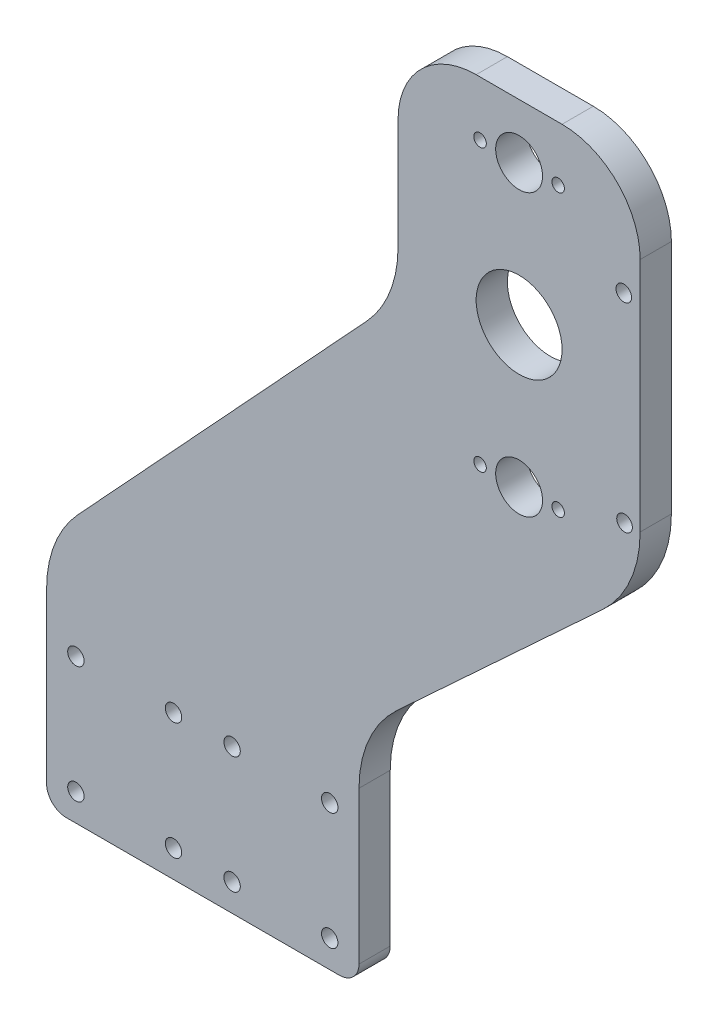
from build123d import *

# Parameters (mm, degrees)
SKETCH1_R           = 2.1
SKETCH1_R_2         = 6
SKETCH1_R_3         = 11
SKETCH1_R_4         = 2
SKETCH1_R_5         = 1.6
BOSS_EXTRUDE1_DEPTH = 8


with BuildPart() as part:
    # Sketch1 → Boss-Extrude1 (new body)
    with BuildSketch(Plane.XY):
        with BuildLine():
            Line((-58.426247288, -99.197523475), (11.573752712, -99.197523475))
            ThreePointArc((11.573752712, -99.197523475), (15.109286618, -97.733057381), (16.573752712, -94.197523475))
            Line((16.573752712, -94.197523475), (16.573752712, -55.206132823))
            ThreePointArc((16.573752712, -55.206132823), (19.086141827, -43.188177597), (26.202502566, -33.18314103))
            Line((26.202502566, -33.18314103), (78.945002858, 15.603630397))
            ThreePointArc((78.945002858, 15.603630397), (86.061363597, 25.608666964), (88.573752712, 37.62662219))
            Line((88.573752712, 37.62662219), (88.573752712, 98.05237335))
            ThreePointArc((88.573752712, 98.05237335), (82.715888336, 112.194508974), (68.573752712, 118.05237335))
            Line((68.573752712, 118.05237335), (46.573752712, 118.05237335))
            ThreePointArc((46.573752712, 118.05237335), (32.431617088, 112.194508974), (26.573752712, 98.05237335))
            Line((26.573752712, 98.05237335), (26.573752712, 69.804033413))
            ThreePointArc((26.573752712, 69.804033413), (24.507075321, 58.861936355), (18.591786844, 49.427424937))
            Line((18.591786844, 49.427424937), (-55.44428142, -30.572575063))
            ThreePointArc((-55.44428142, -30.572575063), (-61.359569897, -40.00708648), (-63.426247288, -50.949183538))
            Line((-63.426247288, -50.949183538), (-63.426247288, -94.197523475))
            ThreePointArc((-63.426247288, -94.197523475), (-61.961781194, -97.733057381), (-58.426247288, -99.197523475))
        make_face()
        with Locations((-55.926247288, -62.197523475)):
            Circle(SKETCH1_R, mode=Mode.SUBTRACT)
        with Locations((-30.926247288, -62.197523475)):
            Circle(SKETCH1_R, mode=Mode.SUBTRACT)
        with Locations((-30.926247288, -92.197523475)):
            Circle(SKETCH1_R, mode=Mode.SUBTRACT)
        with Locations((-55.926247288, -92.197523475)):
            Circle(SKETCH1_R, mode=Mode.SUBTRACT)
        with Locations((9.073752712, -92.197523475)):
            Circle(SKETCH1_R, mode=Mode.SUBTRACT)
        with Locations((-15.926247288, -92.197523475)):
            Circle(SKETCH1_R, mode=Mode.SUBTRACT)
        with Locations((-15.926247288, -62.197523475)):
            Circle(SKETCH1_R, mode=Mode.SUBTRACT)
        with Locations((9.073752712, -62.197523475)):
            Circle(SKETCH1_R, mode=Mode.SUBTRACT)
        with Locations((57.573752712, 104.05237335)):
            Circle(SKETCH1_R_2, mode=Mode.SUBTRACT)
        with Locations((57.573752712, 32.11237335)):
            Circle(SKETCH1_R_2, mode=Mode.SUBTRACT)
        with Locations((57.573752712, 68.08237335)):
            Circle(SKETCH1_R_3, mode=Mode.SUBTRACT)
        with Locations((84.573752712, 37.62662219)):
            Circle(SKETCH1_R_4, mode=Mode.SUBTRACT)
        with Locations((84.375885899, 88.528341433)):
            Circle(SKETCH1_R_4, mode=Mode.SUBTRACT)
        with Locations((47.573752712, 104.05237335)):
            Circle(SKETCH1_R_5, mode=Mode.SUBTRACT)
        with Locations((47.573752712, 32.11237335)):
            Circle(SKETCH1_R_5, mode=Mode.SUBTRACT)
        with Locations((67.573752712, 104.05237335)):
            Circle(SKETCH1_R_5, mode=Mode.SUBTRACT)
        with Locations((67.573752712, 32.11237335)):
            Circle(SKETCH1_R_5, mode=Mode.SUBTRACT)
    extrude(amount=BOSS_EXTRUDE1_DEPTH)


solid = part.part
